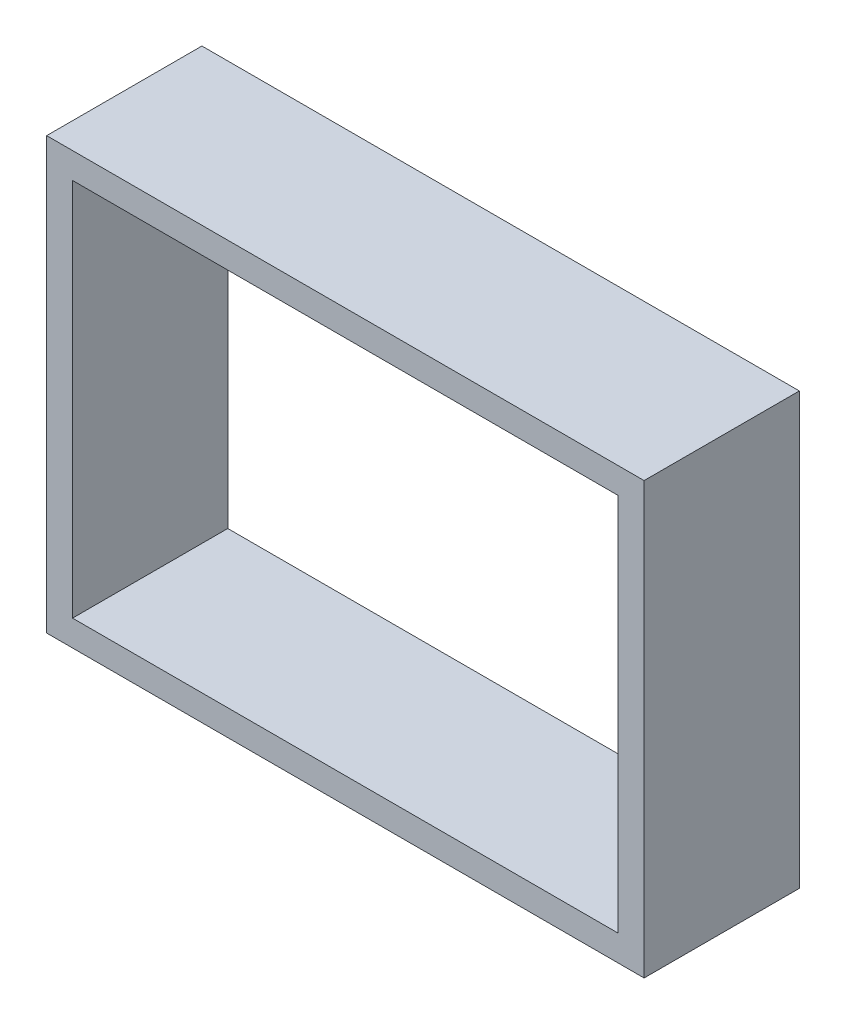
from build123d import *

# Parameters (mm, degrees)
SALIENTE_EXTRUIR1_DEPTH      = 1
SALIENTE_EXTRUIR1_DEPTH_BACK = 23
CROQUIS1_W                   = 92.362259878
CROQUIS1_H                   = 66.6
CROQUIS1_W_2                 = 84.362259878
CROQUIS1_H_2                 = 58.6
CROQUIS2_R                   = 4
CORTAR_EXTRUIR1_DEPTH        = 2


with BuildPart() as part:
    # Croquis1 → Saliente-Extruir1 (new, two sides: drawn at the far end of the back side and taken through both)
    with BuildSketch(Plane.XY.offset(-SALIENTE_EXTRUIR1_DEPTH_BACK)):
        with Locations((-8.130399678, 20.05)):
            Rectangle(CROQUIS1_W, CROQUIS1_H)
        with Locations((-8.130399678, 20.05)):
            Rectangle(CROQUIS1_W_2, CROQUIS1_H_2, mode=Mode.SUBTRACT)
    extrude(amount=SALIENTE_EXTRUIR1_DEPTH + SALIENTE_EXTRUIR1_DEPTH_BACK)

    # Croquis2 → Cortar-Extruir1 (cut)
    with BuildSketch(Plane(origin=(0, -13.25, 0), x_dir=(-1, 0, 0), z_dir=(0, -1, 0))):
        with Locations((48.766605031, 3.90477072)):
            Circle(CROQUIS2_R)
    extrude(amount=-CORTAR_EXTRUIR1_DEPTH, mode=Mode.SUBTRACT)


solid = part.part
